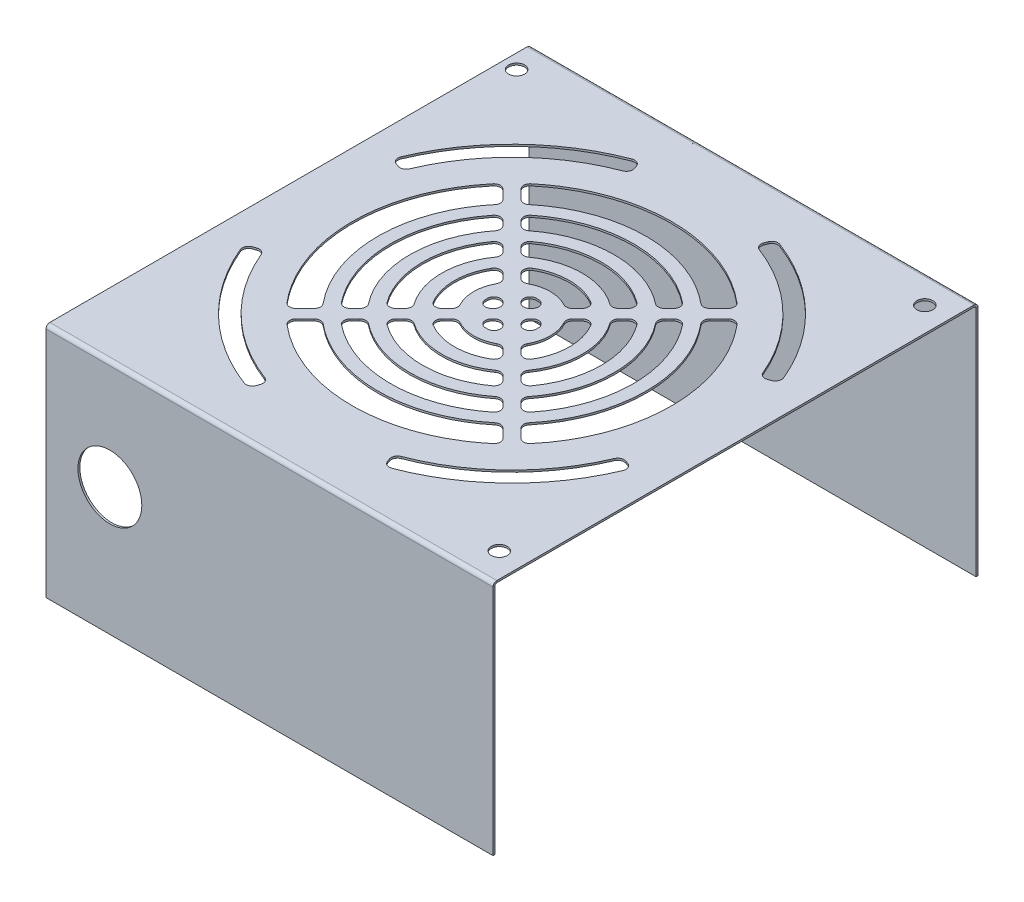
from build123d import *

# Parameters (mm, degrees)
BASE_FLANGE1_DEPTH = 70
VENT1_START        = 73.44
VENT1_DEPTH        = 0.6
CUT_EXTRUDE1_DEPTH = 10
SKETCH8_R          = 10
CUT_EXTRUDE2_DEPTH = 10
SKETCH9_R          = 2.5
CUT_EXTRUDE3_DEPTH = 10


# Read off the part's stored shape, not the designer's step: Vent1
# Sheet-metal steps are written as plain solids
with BuildPart() as part:
    # Sketch1 → Base-Flange1 (new, symmetric)
    with BuildSketch(Plane(origin=(0, 0, 0), x_dir=(0, 0, -1), z_dir=(1, 0, 0))):
        with BuildLine():
            Line((0, 0), (0, 72.84))
            ThreePointArc((0, 72.84), (0.175735931, 73.264264069), (0.6, 73.44))
            Line((0.6, 73.44), (150.07, 73.44))
            ThreePointArc((150.07, 73.44), (150.494264069, 73.264264069), (150.67, 72.84))
            Line((150.67, 72.84), (150.67, 0))
            Line((150.67, 0), (151.27, 0))
            Line((151.27, 0), (151.27, 72.84))
            ThreePointArc((151.27, 72.84), (150.918528137, 73.688528137), (150.07, 74.04))
            Line((150.07, 74.04), (0.6, 74.04))
            ThreePointArc((0.6, 74.04), (-0.248528137, 73.688528137), (-0.6, 72.84))
            Line((-0.6, 72.84), (-0.6, 0))
            Line((-0.6, 0), (0, 0))
        make_face()
    extrude(amount=BASE_FLANGE1_DEPTH, both=True)

    # Vent1 outline → Vent1 (cut)
    with BuildSketch(Plane(origin=(0, 0, 0), x_dir=(1, 0, 0), z_dir=(0, 1, 0)).offset(VENT1_START)):
        with BuildLine():
            ThreePointArc((-35.237668545, 107.74424142), (-36.735185194, 108.328292253), (-38.17889489, 107.621628399))
            add(Edge.make_bspline(
                [(-38.17889489, 107.621628399), (-38.337593554, 107.434004687), (-39.542377698, 105.988034091), (-41.639734537, 103.158002226), (-44.167935511, 98.943358751), (-46.267637176, 94.499881819), (-47.925023327, 89.872993996), (-49.117500466, 85.105265753), (-49.840379372, 80.243942285), (-50.079805759, 75.335183853), (-49.840397589, 70.426242674), (-49.117572202, 65.565094889), (-47.925077278, 60.797183854), (-46.267777889, 56.1704579), (-44.16802313, 51.726805148), (-41.639938796, 47.512303544), (-39.542488916, 44.682113272), (-38.33771236, 43.236135881), (-38.178894637, 43.048371463)],
                knots=[0.388277454, 0.388277454, 0.388277454, 0.388277454, 0.390624117, 0.406249996, 0.421874117, 0.437499996, 0.453124117, 0.468749996, 0.484374117, 0.499999996, 0.515624117, 0.531249996, 0.546874117, 0.562499996, 0.578124117, 0.593749996, 0.609374117, 0.61172254, 0.61172254, 0.61172254, 0.61172254], degree=3))
            ThreePointArc((-38.178894637, 43.048371463), (-36.735184981, 42.341707815), (-35.237668471, 42.925758654))
            Line((-35.237668471, 42.925758654), (-32.398421968, 45.765005157))
            ThreePointArc((-32.398421968, 45.765005157), (-31.814704678, 47.088266478), (-32.275778554, 48.459090054))
            add(Edge.make_bspline(
                [(-32.275778476, 102.210910081), (-32.339681127, 102.134176391), (-33.279116704, 100.997839753), (-34.977369953, 98.70633243), (-37.101062803, 95.166027013), (-38.864810367, 91.433512463), (-40.25701773, 87.546921101), (-41.258697914, 83.542035691), (-41.865918043, 79.458517909), (-42.067036838, 75.335167139), (-41.865934603, 71.211650236), (-41.258763128, 67.128292165), (-40.257066776, 63.123240582), (-38.86493829, 59.23679637), (-37.101142449, 55.504121994), (-34.977555668, 51.963945513), (-33.279217278, 49.67229472), (-32.339788351, 48.535952392), (-32.275778554, 48.459090054)],
                knots=[0.389488825, 0.389488825, 0.389488825, 0.389488825, 0.390624044, 0.406249995, 0.421874044, 0.437499995, 0.453124044, 0.468749995, 0.484374044, 0.499999995, 0.515624044, 0.531249995, 0.546874044, 0.562499995, 0.578124044, 0.593749995, 0.609374044, 0.610511167, 0.610511167, 0.610511167, 0.610511167], degree=3))
            ThreePointArc((-32.275778476, 102.210910081), (-31.8147047, 103.581733617), (-32.398421987, 104.904994862))
            Line((-32.398421987, 104.904994862), (-35.237668545, 107.74424142))
        make_face()
        with BuildLine():
            ThreePointArc((-32.409242255, 40.097330621), (-32.993293095, 38.599814132), (-32.286629479, 37.156104482))
            add(Edge.make_bspline(
                [(-32.286629479, 37.156104482), (-32.099002484, 36.99740299), (-30.653031738, 35.792618801), (-27.822991581, 33.695258793), (-23.608351397, 31.167060385), (-19.164866351, 29.067356461), (-14.537985919, 27.409974211), (-9.770249358, 26.217496276), (-4.908933878, 25.494619798), (-0.000167139, 25.255194241), (4.908765733, 25.494603238), (9.769921504, 26.217431059), (14.53782423, 27.409925174), (19.164557543, 29.067228506), (23.608202294, 31.166980859), (27.822710384, 33.695070464), (30.652893317, 35.792516171), (32.098870457, 36.99729296), (32.286628455, 37.156105228)],
                knots=[0.638277453, 0.638277453, 0.638277453, 0.638277453, 0.640624157, 0.656249996, 0.671874197, 0.687499996, 0.703124197, 0.718749996, 0.734374197, 0.749999996, 0.765624197, 0.781249996, 0.796874197, 0.812499996, 0.828124197, 0.843749996, 0.859374197, 0.861722539, 0.861722539, 0.861722539, 0.861722539], degree=3))
            ThreePointArc((32.286628455, 37.156105228), (32.993292217, 38.599814907), (32.409241381, 40.097331494))
            Line((32.409241381, 40.097331494), (29.569994843, 42.936578032))
            ThreePointArc((29.569994843, 42.936578032), (28.246733522, 43.520295322), (26.875909946, 43.059221446))
            add(Edge.make_bspline(
                [(-26.875910081, 43.059221524), (-26.799176391, 42.995318873), (-25.662839753, 42.055883296), (-23.37133243, 40.357630047), (-19.831027013, 38.233937197), (-16.098512463, 36.470189633), (-12.211921101, 35.07798227), (-8.207035691, 34.076302086), (-4.123517909, 33.469081957), (-0.000167139, 33.267963162), (4.123349764, 33.469065397), (8.206707835, 34.076236872), (12.211759418, 35.077933224), (16.09820363, 36.47006171), (19.830878006, 38.233857551), (23.371054487, 40.357444332), (25.66270528, 42.055782722), (26.799047608, 42.995211649), (26.875909946, 43.059221446)],
                knots=[0.639488825, 0.639488825, 0.639488825, 0.639488825, 0.640624044, 0.656249995, 0.671874044, 0.687499995, 0.703124044, 0.718749995, 0.734374044, 0.749999995, 0.765624044, 0.781249995, 0.796874044, 0.812499995, 0.828124044, 0.843749995, 0.859374044, 0.860511167, 0.860511167, 0.860511167, 0.860511167], degree=3))
            ThreePointArc((-26.875910081, 43.059221524), (-28.246733617, 43.5202953), (-29.569994862, 42.936578013))
            Line((-29.569994862, 42.936578013), (-32.409242255, 40.097330621))
        make_face()
        with BuildLine():
            ThreePointArc((32.409241439, 110.572668563), (32.993292271, 112.070185236), (32.286628381, 113.51389494))
            add(Edge.make_bspline(
                [(32.286628381, 113.51389494), (32.099004677, 113.67259359), (30.653034061, 114.877377664), (27.822998563, 116.974736542), (23.608356035, 119.502939391), (19.164870079, 121.602641643), (14.537985982, 123.260025916), (9.770249341, 124.45250369), (4.908933883, 125.17538021), (0.000167137, 125.414805759), (-4.908765728, 125.175396753), (-9.769921523, 124.452568978), (-14.53782416, 123.260074689), (-19.164553841, 121.602773423), (-23.60819756, 119.503019245), (-27.822700147, 116.974936816), (-30.652886651, 114.877488918), (-32.098864078, 113.672712403), (-32.28662848, 113.513894708)],
                knots=[0.138277454, 0.138277454, 0.138277454, 0.138277454, 0.140624117, 0.156249996, 0.171874157, 0.187499996, 0.203124197, 0.218749996, 0.234374197, 0.249999996, 0.265624197, 0.281249996, 0.296874197, 0.312499996, 0.328124157, 0.343749996, 0.359374117, 0.361722539, 0.361722539, 0.361722539, 0.361722539], degree=3))
            ThreePointArc((-32.28662848, 113.513894708), (-32.993292196, 112.070185039), (-32.409241358, 110.572668483))
            Line((-32.409241358, 110.572668483), (-29.569994843, 107.733421968))
            ThreePointArc((-29.569994843, 107.733421968), (-28.246733522, 107.149704678), (-26.875909946, 107.610778554))
            add(Edge.make_bspline(
                [(26.87591017, 107.610778424), (26.799182886, 107.674675735), (25.662846467, 108.614111594), (23.371342667, 110.312362674), (19.831031747, 112.436062699), (16.098516165, 114.199808438), (12.21192117, 115.592017867), (8.207035672, 116.593697877), (4.123517914, 117.200918052), (0.000167138, 117.402036836), (-4.123349764, 117.200934604), (-8.206707835, 116.593763128), (-12.211759418, 115.592066776), (-16.09820363, 114.19993829), (-19.830878006, 112.436142449), (-23.371054487, 110.312555668), (-25.66270528, 108.614217278), (-26.799047608, 107.674788351), (-26.875909946, 107.610778554)],
                knots=[0.139488824, 0.139488824, 0.139488824, 0.139488824, 0.140623949, 0.156249995, 0.171873996, 0.187499995, 0.203124044, 0.218749995, 0.234374044, 0.249999995, 0.265624044, 0.281249995, 0.296874044, 0.312499995, 0.328124044, 0.343749995, 0.359374044, 0.360511167, 0.360511167, 0.360511167, 0.360511167], degree=3))
            ThreePointArc((26.87591017, 107.610778424), (28.246733679, 107.149704715), (29.569994874, 107.733421999))
            Line((29.569994874, 107.733421999), (32.409241439, 110.572668563))
        make_face()
        with BuildLine():
            ThreePointArc((35.237668542, 42.925758583), (36.735185185, 42.341707749), (38.178894879, 43.048371594))
            add(Edge.make_bspline(
                [(38.178894879, 43.048371594), (38.337598954, 43.236001701), (39.542382752, 44.681972604), (41.639743794, 47.512011677), (44.167939595, 51.726648685), (46.267643196, 56.170133674), (47.925027181, 60.797013899), (49.117508708, 65.564792176), (49.840403961, 70.426105929), (50.000006913, 73.698674722), (50, 75.335), (49.999993088, 76.971236998), (49.840371138, 80.243801135), (49.117566807, 85.10495079), (47.925075713, 89.87281594), (46.26777831, 94.499542157), (44.168023011, 98.943194829), (41.639938851, 103.157696488), (39.542488886, 105.987886622), (38.337712436, 107.433864068), (38.178894755, 107.621628464)],
                knots=[0.888277454, 0.888277454, 0.888277454, 0.888277454, 0.890624197, 0.906249996, 0.921874197, 0.937499996, 0.953124197, 0.968749996, 0.984374599, 1, 1, 1, 1.015624558, 1.031249996, 1.046874117, 1.062499996, 1.078124117, 1.093749996, 1.109374117, 1.111722539, 1.111722539, 1.111722539, 1.111722539], degree=3))
            ThreePointArc((38.178894755, 107.621628464), (36.735185079, 108.328292213), (35.237668501, 107.744241376))
            Line((35.237668501, 107.744241376), (32.398421965, 104.904994841))
            ThreePointArc((32.398421965, 104.904994841), (31.814704675, 103.581733509), (32.275778565, 102.210909927))
            add(Edge.make_bspline(
                [(32.275778474, 48.459089915), (32.339681125, 48.535823606), (33.2791167, 49.672160246), (34.977369926, 51.963667574), (37.101062903, 55.503972973), (38.864809991, 59.236487587), (40.257019132, 63.123078711), (41.258702895, 67.128005846), (41.865941804, 71.211521899), (42.000006913, 73.960480045), (42, 75.335), (41.999993088, 76.709431675), (41.86590898, 79.458385165), (41.258760994, 83.54173712), (40.257067663, 87.546751128), (38.864945105, 91.433188243), (37.101146318, 95.165870541), (34.977564983, 98.706040592), (33.279222316, 100.997698558), (32.339793717, 102.13404116), (32.275778565, 102.210909927)],
                knots=[0.889488825, 0.889488825, 0.889488825, 0.889488825, 0.890624044, 0.906249995, 0.921874044, 0.937499995, 0.953124044, 0.968749995, 0.984374522, 1, 1, 1, 1.015624474, 1.031249995, 1.046873949, 1.062499995, 1.078123949, 1.093749995, 1.109373949, 1.110511166, 1.110511166, 1.110511166, 1.110511166], degree=3))
            ThreePointArc((32.275778474, 48.459089915), (31.814704701, 47.088266381), (32.398421987, 45.765005138))
            Line((32.398421987, 45.765005138), (35.237668542, 42.925758583))
        make_face()
        with BuildLine():
            ThreePointArc((1.748044523, 79.911471648), (2.202201241, 82.039262464), (0.445257533, 83.322578828))
            add(Edge.make_bspline(
                [(0.445257533, 83.322578828), (0.296991368, 83.330852074), (0, 83.339147926), (-0.296991368, 83.330852074), (-0.445257551, 83.322578827)],
                knots=[0.241137243, 0.241137243, 0.241137243, 0.241137243, 0.25, 0.258862757, 0.258862757, 0.258862757, 0.258862757], degree=3))
            ThreePointArc((-0.445257551, 83.322578827), (-2.202201241, 82.039262465), (-1.748044523, 79.911471648))
            Line((-1.748044523, 79.911471648), (-1.414213562, 79.577640687))
            ThreePointArc((-1.414213562, 79.577640687), (0, 78.991854249), (1.414213562, 79.577640687))
            Line((1.414213562, 79.577640687), (1.748044523, 79.911471648))
        make_face()
        with BuildLine():
            add(Edge.make_bspline(
                [(5.707183993, 85.89089554), (5.344945674, 86.086740839), (4.26255561, 86.601997096), (2.356174944, 87.180291349), (0, 87.412354326), (-2.356174944, 87.180291349), (-4.262555613, 86.601997095), (-5.344945679, 86.086740836), (-5.707184, 85.890895536)],
                knots=[0.171115403, 0.171115403, 0.171115403, 0.171115403, 0.1875, 0.21875, 0.25, 0.28125, 0.3125, 0.328884597, 0.328884597, 0.328884597, 0.328884597], degree=3))
            ThreePointArc((5.707183993, 85.89089554), (6.947118124, 85.671179092), (8.072584978, 86.236012103))
            Line((8.072584978, 86.236012103), (9.540203201, 87.703630326))
            ThreePointArc((9.540203201, 87.703630326), (10.110041057, 89.369915248), (9.141633618, 90.840767945))
            add(Edge.make_bspline(
                [(9.141633618, 90.840767945), (8.417949604, 91.267371377), (6.607666297, 92.170630149), (3.534262417, 93.102937023), (0, 93.451031488), (-3.534262417, 93.102937023), (-6.607666296, 92.170630149), (-8.417949603, 91.267371378), (-9.141633653, 90.840767925)],
                knots=[0.165216574, 0.165216574, 0.165216574, 0.165216574, 0.1875, 0.21875, 0.25, 0.28125, 0.3125, 0.334783426, 0.334783426, 0.334783426, 0.334783426], degree=3))
            ThreePointArc((-9.141633653, 90.840767925), (-10.110041057, 89.369915248), (-9.540203201, 87.703630326))
            Line((-9.540203201, 87.703630326), (-8.072584978, 86.236012103))
            ThreePointArc((-8.072584978, 86.236012103), (-6.947118124, 85.671179092), (-5.707184, 85.890895536))
        make_face()
        with BuildLine():
            ThreePointArc((-4.576471648, 77.083044523), (-6.704262464, 77.537201241), (-7.987578828, 75.780257533))
            add(Edge.make_bspline(
                [(-7.987578828, 75.780257533), (-7.995852074, 75.631991368), (-8.004147926, 75.335), (-7.995852074, 75.038008632), (-7.987578827, 74.889742449)],
                knots=[0.491137243, 0.491137243, 0.491137243, 0.491137243, 0.5, 0.508862757, 0.508862757, 0.508862757, 0.508862757], degree=3))
            ThreePointArc((-7.987578827, 74.889742449), (-6.704262465, 73.132798759), (-4.576471648, 73.586955477))
            Line((-4.576471648, 73.586955477), (-4.242640687, 73.920786438))
            ThreePointArc((-4.242640687, 73.920786438), (-3.656854249, 75.335), (-4.242640687, 76.749213562))
            Line((-4.242640687, 76.749213562), (-4.576471648, 77.083044523))
        make_face()
        with BuildLine():
            add(Edge.make_bspline(
                [(-10.55589554, 81.042183993), (-10.751740839, 80.679945674), (-11.266997096, 79.59755561), (-11.845291349, 77.691174944), (-12.077354326, 75.335), (-11.845291349, 72.978825056), (-11.266997095, 71.072444387), (-10.751740836, 69.990054321), (-10.555895536, 69.627816)],
                knots=[0.421115403, 0.421115403, 0.421115403, 0.421115403, 0.4375, 0.46875, 0.5, 0.53125, 0.5625, 0.578884597, 0.578884597, 0.578884597, 0.578884597], degree=3))
            ThreePointArc((-10.55589554, 81.042183993), (-10.336179092, 82.282118124), (-10.901012103, 83.407584978))
            Line((-10.901012103, 83.407584978), (-12.368630326, 84.875203201))
            ThreePointArc((-12.368630326, 84.875203201), (-14.034915248, 85.445041057), (-15.505767945, 84.476633618))
            add(Edge.make_bspline(
                [(-15.505767945, 84.476633618), (-15.932371377, 83.752949604), (-16.835630149, 81.942666297), (-17.767937023, 78.869262417), (-18.116031488, 75.335), (-17.767937023, 71.800737583), (-16.835630149, 68.727333704), (-15.932371378, 66.917050397), (-15.505767925, 66.193366347)],
                knots=[0.415216574, 0.415216574, 0.415216574, 0.415216574, 0.4375, 0.46875, 0.5, 0.53125, 0.5625, 0.584783426, 0.584783426, 0.584783426, 0.584783426], degree=3))
            ThreePointArc((-15.505767925, 66.193366347), (-14.034915248, 65.224958943), (-12.368630326, 65.794796799))
            Line((-12.368630326, 65.794796799), (-10.901012103, 67.262415022))
            ThreePointArc((-10.901012103, 67.262415022), (-10.336179092, 68.387881876), (-10.555895536, 69.627816))
        make_face()
        with BuildLine():
            ThreePointArc((-1.748044523, 70.758528352), (-2.202201241, 68.630737536), (-0.445257533, 67.347421172))
            add(Edge.make_bspline(
                [(-0.445257533, 67.347421172), (-0.296991368, 67.339147926), (0, 67.330852074), (0.296991368, 67.339147926), (0.445257551, 67.347421173)],
                knots=[0.741137243, 0.741137243, 0.741137243, 0.741137243, 0.75, 0.758862757, 0.758862757, 0.758862757, 0.758862757], degree=3))
            ThreePointArc((0.445257551, 67.347421173), (2.202201241, 68.630737535), (1.748044523, 70.758528352))
            Line((1.748044523, 70.758528352), (1.414213562, 71.092359313))
            ThreePointArc((1.414213562, 71.092359313), (0, 71.678145751), (-1.414213562, 71.092359313))
            Line((-1.414213562, 71.092359313), (-1.748044523, 70.758528352))
        make_face()
        with BuildLine():
            add(Edge.make_bspline(
                [(-5.707183993, 64.77910446), (-5.344945674, 64.583259161), (-4.26255561, 64.068002904), (-2.356174944, 63.489708651), (0, 63.257645674), (2.356174944, 63.489708651), (4.262555613, 64.068002905), (5.344945679, 64.583259164), (5.707184, 64.779104464)],
                knots=[0.671115403, 0.671115403, 0.671115403, 0.671115403, 0.6875, 0.71875, 0.75, 0.78125, 0.8125, 0.828884597, 0.828884597, 0.828884597, 0.828884597], degree=3))
            ThreePointArc((-5.707183993, 64.77910446), (-6.947118124, 64.998820908), (-8.072584978, 64.433987897))
            Line((-8.072584978, 64.433987897), (-9.540203201, 62.966369674))
            ThreePointArc((-9.540203201, 62.966369674), (-10.110041057, 61.300084752), (-9.141633618, 59.829232055))
            add(Edge.make_bspline(
                [(-9.141633618, 59.829232055), (-8.417949604, 59.402628623), (-6.607666297, 58.499369851), (-3.534262417, 57.567062977), (0, 57.218968512), (3.534262417, 57.567062977), (6.607666296, 58.499369851), (8.417949603, 59.402628622), (9.141633653, 59.829232075)],
                knots=[0.665216574, 0.665216574, 0.665216574, 0.665216574, 0.6875, 0.71875, 0.75, 0.78125, 0.8125, 0.834783426, 0.834783426, 0.834783426, 0.834783426], degree=3))
            ThreePointArc((9.141633653, 59.829232075), (10.110041057, 61.300084752), (9.540203201, 62.966369674))
            Line((9.540203201, 62.966369674), (8.072584978, 64.433987897))
            ThreePointArc((8.072584978, 64.433987897), (6.947118124, 64.998820908), (5.707184, 64.779104464))
        make_face()
        with BuildLine():
            add(Edge.make_bspline(
                [(10.55589554, 69.627816007), (10.751740839, 69.990054326), (11.266997096, 71.07244439), (11.845291349, 72.978825056), (12, 74.549608352), (12, 75.335), (12, 76.120391648), (11.845291349, 77.691174944), (11.266997095, 79.597555613), (10.751740836, 80.679945679), (10.555895536, 81.042184)],
                knots=[0.921115403, 0.921115403, 0.921115403, 0.921115403, 0.9375, 0.96875, 1, 1, 1, 1.03125, 1.0625, 1.078884597, 1.078884597, 1.078884597, 1.078884597], degree=3))
            ThreePointArc((10.55589554, 69.627816007), (10.336179092, 68.387881876), (10.901012103, 67.262415022))
            Line((10.901012103, 67.262415022), (12.368630326, 65.794796799))
            ThreePointArc((12.368630326, 65.794796799), (14.034915248, 65.224958943), (15.505767945, 66.193366382))
            add(Edge.make_bspline(
                [(15.505767945, 66.193366382), (15.932371377, 66.917050396), (16.835630149, 68.727333703), (17.767937023, 71.800737583), (18, 74.156912528), (18, 75.335), (18, 76.513087472), (17.767937023, 78.869262417), (16.835630149, 81.942666296), (15.932371378, 83.752949603), (15.505767925, 84.476633653)],
                knots=[0.915216574, 0.915216574, 0.915216574, 0.915216574, 0.9375, 0.96875, 1, 1, 1, 1.03125, 1.0625, 1.084783426, 1.084783426, 1.084783426, 1.084783426], degree=3))
            ThreePointArc((15.505767925, 84.476633653), (14.034915248, 85.445041057), (12.368630326, 84.875203201))
            Line((12.368630326, 84.875203201), (10.901012103, 83.407584978))
            ThreePointArc((10.901012103, 83.407584978), (10.336179092, 82.282118124), (10.555895536, 81.042184))
        make_face()
        with BuildLine():
            ThreePointArc((4.576471648, 73.586955477), (6.704262466, 73.13279876), (7.987578828, 74.889742471))
            add(Edge.make_bspline(
                [(7.987578828, 74.889742471), (7.995852074, 75.038008632), (8, 75.186504316), (8, 75.335), (8, 75.483495684), (7.995852074, 75.631991368), (7.987578827, 75.780257551)],
                knots=[0.991137243, 0.991137243, 0.991137243, 0.991137243, 1, 1, 1, 1.008862757, 1.008862757, 1.008862757, 1.008862757], degree=3))
            ThreePointArc((7.987578827, 75.780257551), (6.704262463, 77.537201241), (4.576471648, 77.083044523))
            Line((4.576471648, 77.083044523), (4.242640687, 76.749213562))
            ThreePointArc((4.242640687, 76.749213562), (3.656854249, 75.335), (4.242640687, 73.920786438))
            Line((4.242640687, 73.920786438), (4.576471648, 73.586955477))
        make_face()
        with BuildLine():
            add(Edge.make_bspline(
                [(12.745942792, 93.266536196), (12.573229067, 93.389317759), (11.213115362, 94.326912376), (8.473306247, 95.791370859), (4.319654065, 97.051367473), (0, 97.476816264), (-4.319654065, 97.051367473), (-8.473306247, 95.791370859), (-11.213115362, 94.326912376), (-12.573229067, 93.389317759), (-12.745942792, 93.266536196)],
                knots=[0.15165093, 0.15165093, 0.15165093, 0.15165093, 0.15625, 0.1875, 0.21875, 0.25, 0.28125, 0.3125, 0.34375, 0.34834907, 0.34834907, 0.34834907, 0.34834907], degree=3))
            ThreePointArc((12.745942792, 93.266536196), (14.071959063, 92.90361345), (15.31897145, 93.482398575))
            Line((15.31897145, 93.482398575), (16.751653306, 94.91508043))
            ThreePointArc((16.751653306, 94.91508043), (17.331483334, 96.483534585), (16.517351618, 97.944164875))
            add(Edge.make_bspline(
                [(16.517351618, 97.944164875), (16.201632209, 98.174846526), (14.37874274, 99.449062219), (10.78420795, 101.370381093), (5.497741537, 102.974013147), (0, 103.515493426), (-5.497741537, 102.974013147), (-10.78420795, 101.370381093), (-14.37874274, 99.449062219), (-16.201632209, 98.174846526), (-16.517351619, 97.944164875)],
                knots=[0.149582268, 0.149582268, 0.149582268, 0.149582268, 0.15625, 0.1875, 0.21875, 0.25, 0.28125, 0.3125, 0.34375, 0.350417732, 0.350417732, 0.350417732, 0.350417732], degree=3))
            ThreePointArc((-16.517351619, 97.944164875), (-17.331483334, 96.483534584), (-16.751653306, 94.91508043))
            Line((-16.751653306, 94.91508043), (-15.31897145, 93.482398575))
            ThreePointArc((-15.31897145, 93.482398575), (-14.07195906, 92.90361345), (-12.745942792, 93.266536196))
        make_face()
        with BuildLine():
            add(Edge.make_bspline(
                [(-17.931536196, 88.080942792), (-18.054317759, 87.908229067), (-18.991912376, 86.548115362), (-20.456370859, 83.808306247), (-21.716367473, 79.654654065), (-22.141816264, 75.335), (-21.716367473, 71.015345935), (-20.456370859, 66.861693753), (-18.991912376, 64.121884638), (-18.054317759, 62.761770933), (-17.931536196, 62.589057208)],
                knots=[0.40165093, 0.40165093, 0.40165093, 0.40165093, 0.40625, 0.4375, 0.46875, 0.5, 0.53125, 0.5625, 0.59375, 0.59834907, 0.59834907, 0.59834907, 0.59834907], degree=3))
            ThreePointArc((-17.931536196, 88.080942792), (-17.56861345, 89.406959063), (-18.147398575, 90.65397145))
            Line((-18.147398575, 90.65397145), (-19.58008043, 92.086653306))
            ThreePointArc((-19.58008043, 92.086653306), (-21.148534585, 92.666483334), (-22.609164875, 91.852351618))
            add(Edge.make_bspline(
                [(-22.609164875, 91.852351618), (-22.839846526, 91.536632209), (-24.114062219, 89.71374274), (-26.035381093, 86.11920795), (-27.639013147, 80.832741537), (-28.180493426, 75.335), (-27.639013147, 69.837258463), (-26.035381093, 64.55079205), (-24.114062219, 60.95625726), (-22.839846526, 59.133367791), (-22.609164875, 58.817648381)],
                knots=[0.399582268, 0.399582268, 0.399582268, 0.399582268, 0.40625, 0.4375, 0.46875, 0.5, 0.53125, 0.5625, 0.59375, 0.600417732, 0.600417732, 0.600417732, 0.600417732], degree=3))
            ThreePointArc((-22.609164875, 58.817648381), (-21.148534584, 58.003516666), (-19.58008043, 58.583346694))
            Line((-19.58008043, 58.583346694), (-18.147398575, 60.01602855))
            ThreePointArc((-18.147398575, 60.01602855), (-17.56861345, 61.26304094), (-17.931536196, 62.589057208))
        make_face()
        with BuildLine():
            add(Edge.make_bspline(
                [(-12.745942792, 57.403463804), (-12.573229067, 57.280682241), (-11.213115362, 56.343087624), (-8.473306247, 54.878629141), (-4.319654065, 53.618632527), (0, 53.193183736), (4.319654065, 53.618632527), (8.473306247, 54.878629141), (11.213115362, 56.343087624), (12.573229067, 57.280682241), (12.745942792, 57.403463804)],
                knots=[0.65165093, 0.65165093, 0.65165093, 0.65165093, 0.65625, 0.6875, 0.71875, 0.75, 0.78125, 0.8125, 0.84375, 0.84834907, 0.84834907, 0.84834907, 0.84834907], degree=3))
            ThreePointArc((-12.745942792, 57.403463804), (-14.071959063, 57.76638655), (-15.31897145, 57.187601425))
            Line((-15.31897145, 57.187601425), (-16.751653306, 55.75491957))
            ThreePointArc((-16.751653306, 55.75491957), (-17.331483334, 54.186465415), (-16.517351618, 52.725835125))
            add(Edge.make_bspline(
                [(-16.517351618, 52.725835125), (-16.201632209, 52.495153474), (-14.37874274, 51.220937781), (-10.78420795, 49.299618907), (-5.497741537, 47.695986853), (0, 47.154506574), (5.497741537, 47.695986853), (10.78420795, 49.299618907), (14.37874274, 51.220937781), (16.201632209, 52.495153474), (16.517351619, 52.725835125)],
                knots=[0.649582268, 0.649582268, 0.649582268, 0.649582268, 0.65625, 0.6875, 0.71875, 0.75, 0.78125, 0.8125, 0.84375, 0.850417732, 0.850417732, 0.850417732, 0.850417732], degree=3))
            ThreePointArc((16.517351619, 52.725835125), (17.331483334, 54.186465416), (16.751653306, 55.75491957))
            Line((16.751653306, 55.75491957), (15.31897145, 57.187601425))
            ThreePointArc((15.31897145, 57.187601425), (14.07195906, 57.76638655), (12.745942792, 57.403463804))
        make_face()
        with BuildLine():
            add(Edge.make_bspline(
                [(17.931536196, 62.589057208), (18.054317759, 62.761770933), (18.991912376, 64.121884638), (20.456370859, 66.861693753), (21.716367473, 71.015345935), (22, 73.895115312), (22, 75.335), (22, 76.774884688), (21.716367473, 79.654654065), (20.456370859, 83.808306247), (18.991912376, 86.548115362), (18.054317759, 87.908229067), (17.931536196, 88.080942792)],
                knots=[0.90165093, 0.90165093, 0.90165093, 0.90165093, 0.90625, 0.9375, 0.96875, 1, 1, 1, 1.03125, 1.0625, 1.09375, 1.09834907, 1.09834907, 1.09834907, 1.09834907], degree=3))
            ThreePointArc((17.931536196, 62.589057208), (17.56861345, 61.263040937), (18.147398575, 60.01602855))
            Line((18.147398575, 60.01602855), (19.58008043, 58.583346694))
            ThreePointArc((19.58008043, 58.583346694), (21.148534585, 58.003516666), (22.609164875, 58.817648382))
            add(Edge.make_bspline(
                [(22.609164875, 58.817648382), (22.839846526, 59.133367791), (24.114062219, 60.95625726), (26.035381093, 64.55079205), (27.639013147, 69.837258463), (28, 73.502419488), (28, 75.335), (28, 77.167580512), (27.639013147, 80.832741537), (26.035381093, 86.11920795), (24.114062219, 89.71374274), (22.839846526, 91.536632209), (22.609164875, 91.852351619)],
                knots=[0.899582268, 0.899582268, 0.899582268, 0.899582268, 0.90625, 0.9375, 0.96875, 1, 1, 1, 1.03125, 1.0625, 1.09375, 1.100417732, 1.100417732, 1.100417732, 1.100417732], degree=3))
            ThreePointArc((22.609164875, 91.852351619), (21.148534584, 92.666483334), (19.58008043, 92.086653306))
            Line((19.58008043, 92.086653306), (18.147398575, 90.65397145))
            ThreePointArc((18.147398575, 90.65397145), (17.56861345, 89.40695906), (17.931536196, 88.080942792))
        make_face()
        with BuildLine():
            add(Edge.make_bspline(
                [(19.808104351, 100.4672827), (19.151097198, 100.985138172), (16.778177952, 102.709345997), (12.324809086, 105.089721249), (6.283133185, 106.922443597), (0, 107.541278202), (-6.283133185, 106.922443597), (-12.324809086, 105.089721249), (-16.778177952, 102.709345997), (-19.151097198, 100.985138172), (-19.808104351, 100.4672827)],
                knots=[0.143767906, 0.143767906, 0.143767906, 0.143767906, 0.15625, 0.1875, 0.21875, 0.25, 0.28125, 0.3125, 0.34375, 0.356232094, 0.356232094, 0.356232094, 0.356232094], degree=3))
            ThreePointArc((19.808104351, 100.4672827), (21.163986968, 100.041491517), (22.460377231, 100.623804356))
            Line((22.460377231, 100.623804356), (23.884305795, 102.04773292))
            ThreePointArc((23.884305795, 102.04773292), (24.466988647, 103.573322914), (23.718268703, 105.024654228))
            add(Edge.make_bspline(
                [(23.718268703, 105.024654228), (22.876974493, 105.696618413), (21.00220811, 107.067140169), (17.942372319, 108.902620473), (14.565350949, 110.498387369), (11.048896779, 111.758011252), (7.425445249, 112.664291747), (3.730818331, 113.213686134), (0.000183853, 113.395652378), (-3.730633372, 113.213704351), (-7.425084608, 112.664363483), (-11.048718928, 111.758065202), (-14.565011232, 110.498528084), (-17.942208411, 108.902708084), (-21.002059862, 107.067248572), (-22.876974629, 105.696618483), (-23.71826887, 105.024654158)],
                knots=[0.142721099, 0.142721099, 0.142721099, 0.142721099, 0.156249994, 0.171873838, 0.187499994, 0.203123838, 0.218749994, 0.234373838, 0.249999994, 0.265623838, 0.281249994, 0.296873838, 0.312499994, 0.328123838, 0.343749994, 0.357278892, 0.357278892, 0.357278892, 0.357278892], degree=3))
            ThreePointArc((-23.71826887, 105.024654158), (-24.466988687, 103.573322865), (-23.88430583, 102.047732955))
            Line((-23.88430583, 102.047732955), (-22.460377231, 100.623804356))
            ThreePointArc((-22.460377231, 100.623804356), (-21.163986971, 100.041491517), (-19.808104351, 100.4672827))
        make_face()
        with BuildLine():
            add(Edge.make_bspline(
                [(-25.1322827, 95.143104351), (-25.650138172, 94.486097198), (-27.374345997, 92.113177952), (-29.754721249, 87.659809086), (-31.587443597, 81.618133185), (-32.206278202, 75.335), (-31.587443597, 69.051866815), (-29.754721249, 63.010190914), (-27.374345997, 58.556822048), (-25.650138172, 56.183902802), (-25.1322827, 55.526895649)],
                knots=[0.393767906, 0.393767906, 0.393767906, 0.393767906, 0.40625, 0.4375, 0.46875, 0.5, 0.53125, 0.5625, 0.59375, 0.606232094, 0.606232094, 0.606232094, 0.606232094], degree=3))
            ThreePointArc((-25.1322827, 95.143104351), (-24.706491517, 96.498986968), (-25.288804356, 97.795377231))
            Line((-25.288804356, 97.795377231), (-26.71273292, 99.219305795))
            ThreePointArc((-26.71273292, 99.219305795), (-28.238322914, 99.801988647), (-29.689654228, 99.053268703))
            add(Edge.make_bspline(
                [(-29.689654228, 99.053268703), (-30.361618413, 98.211974493), (-31.732140169, 96.33720811), (-33.567620473, 93.277372319), (-35.163387369, 89.900350949), (-36.423011252, 86.383896779), (-37.329291747, 82.760445249), (-37.878686134, 79.065818331), (-38.060652378, 75.335183853), (-37.878704351, 71.604366628), (-37.329363483, 67.909915392), (-36.423065203, 64.286281072), (-35.163528082, 60.76998877), (-33.567708091, 57.392791581), (-31.732248533, 54.332940144), (-30.361618498, 52.458025272), (-29.689654124, 51.616731045)],
                knots=[0.392721099, 0.392721099, 0.392721099, 0.392721099, 0.406249994, 0.421873838, 0.437499994, 0.453123838, 0.468749994, 0.484373838, 0.499999994, 0.515623838, 0.531249994, 0.546873838, 0.562499994, 0.578123838, 0.593749994, 0.607278892, 0.607278892, 0.607278892, 0.607278892], degree=3))
            ThreePointArc((-29.689654124, 51.616731045), (-28.238322842, 50.868011292), (-26.712732974, 51.450694151))
            Line((-26.712732974, 51.450694151), (-25.288804356, 52.874622769))
            ThreePointArc((-25.288804356, 52.874622769), (-24.706491517, 54.171013029), (-25.1322827, 55.526895649))
        make_face()
        with BuildLine():
            add(Edge.make_bspline(
                [(-19.808104351, 50.2027173), (-19.151097198, 49.684861828), (-16.778177952, 47.960654003), (-12.324809086, 45.580278751), (-6.283133185, 43.747556403), (0, 43.128721798), (6.283133185, 43.747556403), (12.324809086, 45.580278751), (16.778177952, 47.960654003), (19.151097198, 49.684861828), (19.808104351, 50.2027173)],
                knots=[0.643767906, 0.643767906, 0.643767906, 0.643767906, 0.65625, 0.6875, 0.71875, 0.75, 0.78125, 0.8125, 0.84375, 0.856232094, 0.856232094, 0.856232094, 0.856232094], degree=3))
            ThreePointArc((-19.808104351, 50.2027173), (-21.163986968, 50.628508483), (-22.460377231, 50.046195644))
            Line((-22.460377231, 50.046195644), (-23.884306644, 48.622266231))
            ThreePointArc((-23.884306644, 48.622266231), (-24.466989486, 47.096676059), (-23.718269273, 45.645344701))
            add(Edge.make_bspline(
                [(-23.718269273, 45.645344701), (-22.876975008, 44.973380717), (-21.002200978, 43.602855292), (-17.942364964, 41.767375423), (-14.565335481, 40.171606268), (-11.048888702, 38.911986286), (-7.425428855, 38.005704995), (-3.730809924, 37.456313036), (-0.000167139, 37.274347622), (3.73064178, 37.456296476), (7.425101001, 38.005639778), (11.048727012, 38.911937249), (14.565026673, 40.171478313), (17.942215862, 41.767295897), (21.002066601, 43.602756356), (22.876974623, 44.973381519), (23.718268862, 45.645345839)],
                knots=[0.642721101, 0.642721101, 0.642721101, 0.642721101, 0.656249995, 0.671873944, 0.687499995, 0.703123944, 0.718749995, 0.734373944, 0.749999995, 0.765623944, 0.781249995, 0.796873944, 0.812499995, 0.828123944, 0.843749995, 0.857278892, 0.857278892, 0.857278892, 0.857278892], degree=3))
            ThreePointArc((23.718268862, 45.645345839), (24.466988685, 47.096677133), (23.884305829, 48.622267047))
            Line((23.884305829, 48.622267047), (22.460377231, 50.046195644))
            ThreePointArc((22.460377231, 50.046195644), (21.163986971, 50.628508483), (19.808104351, 50.2027173))
        make_face()
        with BuildLine():
            add(Edge.make_bspline(
                [(25.1322827, 55.526895649), (25.650138172, 56.183902802), (27.374345997, 58.556822048), (29.754721249, 63.010190914), (31.587443597, 69.051866815), (32, 73.240622272), (32, 75.335), (32, 77.429377728), (31.587443597, 81.618133185), (29.754721249, 87.659809086), (27.374345997, 92.113177952), (25.650138172, 94.486097198), (25.1322827, 95.143104351)],
                knots=[0.893767906, 0.893767906, 0.893767906, 0.893767906, 0.90625, 0.9375, 0.96875, 1, 1, 1, 1.03125, 1.0625, 1.09375, 1.106232094, 1.106232094, 1.106232094, 1.106232094], degree=3))
            ThreePointArc((25.1322827, 55.526895649), (24.706491517, 54.171013032), (25.288804356, 52.874622769))
            Line((25.288804356, 52.874622769), (26.71273292, 51.450694204))
            ThreePointArc((26.71273292, 51.450694204), (28.238322915, 50.868011352), (29.689654229, 51.616731297))
            add(Edge.make_bspline(
                [(29.689654229, 51.616731297), (30.361618414, 52.458025506), (31.732145076, 54.332798634), (33.567624557, 57.392635117), (35.163393389, 60.769664544), (36.423015107, 64.286111117), (37.329299989, 67.909612681), (37.878710725, 71.604229883), (38.000006913, 74.091382707), (38, 75.335), (37.999993088, 76.578529013), (37.878677901, 79.06567718), (37.329358088, 82.760130285), (36.423063638, 86.383718722), (35.163528503, 89.900011287), (33.567707972, 93.277208396), (31.732248594, 96.337059868), (30.361618487, 98.211974636), (29.689654153, 99.053268878)],
                knots=[0.8927211, 0.8927211, 0.8927211, 0.8927211, 0.906249995, 0.921873944, 0.937499995, 0.953123944, 0.968749995, 0.984374472, 1, 1, 1, 1.015624419, 1.031249994, 1.046873838, 1.062499994, 1.078123838, 1.093749994, 1.107278892, 1.107278892, 1.107278892, 1.107278892], degree=3))
            ThreePointArc((29.689654153, 99.053268878), (28.238322862, 99.801988688), (26.712732956, 99.219305831))
            Line((26.712732956, 99.219305831), (25.288804356, 97.795377231))
            ThreePointArc((25.288804356, 97.795377231), (24.706491517, 96.498986971), (25.1322827, 95.143104351))
        make_face()
    extrude(amount=VENT1_DEPTH, mode=Mode.SUBTRACT)

    # Sketch7 → Cut-Extrude1 (cut)
    with BuildSketch(Plane(origin=(0, 74.04, 0), x_dir=(1, 0, 0), z_dir=(0, 1, 0))):
        with BuildLine():
            Line((-58.772721438, 97.842191436), (-57.83190902, 97.499763719))
            ThreePointArc((-57.83190902, 97.499763719), (-56.347462216, 97.546296155), (-55.304389097, 98.603531253))
            ThreePointArc((-55.304389097, 98.603531253), (-41.702552938, 118.473116307), (-21.38416897, 131.394943966))
            ThreePointArc((-21.38416897, 131.394943966), (-20.277925621, 132.432308094), (-20.217589361, 133.947649051))
            Line((-20.217589361, 133.947649051), (-20.559649158, 134.88745062))
            ThreePointArc((-20.559649158, 134.88745062), (-21.607512123, 136.022358025), (-23.151384698, 136.072248757))
            ThreePointArc((-23.151384698, 136.072248757), (-45.190328449, 122.055811366), (-59.932766268, 100.495753715))
            ThreePointArc((-59.932766268, 100.495753715), (-59.921221112, 98.920454155), (-58.772721438, 97.842191436))
        make_face()
        with BuildLine():
            Line((20.559649158, 134.88745062), (20.217589361, 133.947649051))
            ThreePointArc((20.217589361, 133.947649051), (20.277925621, 132.432308094), (21.38416897, 131.394943966))
            ThreePointArc((21.38416897, 131.394943966), (41.702552938, 118.473116307), (55.304389097, 98.603531253))
            ThreePointArc((55.304389097, 98.603531253), (56.347462216, 97.546296155), (57.83190902, 97.499763719))
            Line((57.83190902, 97.499763719), (58.772721438, 97.842191436))
            ThreePointArc((58.772721438, 97.842191436), (59.921221112, 98.920454155), (59.932766268, 100.495753715))
            ThreePointArc((59.932766268, 100.495753715), (45.190328449, 122.055811366), (23.151384698, 136.072248757))
            ThreePointArc((23.151384698, 136.072248757), (21.607512123, 136.022358025), (20.559649158, 134.88745062))
        make_face()
        with BuildLine():
            Line((58.772721438, 52.827808564), (57.83190902, 53.170236281))
            ThreePointArc((57.83190902, 53.170236281), (56.347462216, 53.123703845), (55.304389097, 52.066468747))
            ThreePointArc((55.304389097, 52.066468747), (41.702552938, 32.196883693), (21.38416897, 19.275056034))
            ThreePointArc((21.38416897, 19.275056034), (20.277925621, 18.237691906), (20.217589361, 16.722350949))
            Line((20.217589361, 16.722350949), (20.559649158, 15.78254938))
            ThreePointArc((20.559649158, 15.78254938), (21.607512123, 14.647641975), (23.151384698, 14.597751243))
            ThreePointArc((23.151384698, 14.597751243), (45.190328449, 28.614188634), (59.932766268, 50.174246285))
            ThreePointArc((59.932766268, 50.174246285), (59.921221112, 51.749545845), (58.772721438, 52.827808564))
        make_face()
        with BuildLine():
            Line((-20.559649158, 15.78254938), (-20.217589361, 16.722350949))
            ThreePointArc((-20.217589361, 16.722350949), (-20.277925621, 18.237691906), (-21.38416897, 19.275056034))
            ThreePointArc((-21.38416897, 19.275056034), (-41.702552938, 32.196883693), (-55.304389097, 52.066468747))
            ThreePointArc((-55.304389097, 52.066468747), (-56.347462216, 53.123703845), (-57.83190902, 53.170236281))
            Line((-57.83190902, 53.170236281), (-58.772721438, 52.827808564))
            ThreePointArc((-58.772721438, 52.827808564), (-59.921221112, 51.749545845), (-59.932766268, 50.174246285))
            ThreePointArc((-59.932766268, 50.174246285), (-45.190328449, 28.614188634), (-23.151384698, 14.597751243))
            ThreePointArc((-23.151384698, 14.597751243), (-21.607512123, 14.647641975), (-20.559649158, 15.78254938))
        make_face()
    extrude(amount=-CUT_EXTRUDE1_DEPTH, mode=Mode.SUBTRACT)

    # Sketch8 → Cut-Extrude2 (cut)
    with BuildSketch(Plane.XY.offset(0.6)):
        with Locations((-50, 40)):
            Circle(SKETCH8_R)
    extrude(amount=-CUT_EXTRUDE2_DEPTH, mode=Mode.SUBTRACT)

    # Sketch9 → Cut-Extrude3 (cut)
    with BuildSketch(Plane(origin=(0, 74.04, 0), x_dir=(1, 0, 0), z_dir=(0, 1, 0))):
        with Locations(Location((-65.5, 142.27, 0), (0, 0, 270))):
            Circle(SKETCH9_R)
        with Locations(Location((62.35, 142.27, 0), (0, 0, 270))):
            Circle(SKETCH9_R)
        with Locations(Location((62.35, 9, 0), (0, 0, 270))):
            Circle(SKETCH9_R)
    extrude(amount=-CUT_EXTRUDE3_DEPTH, mode=Mode.SUBTRACT)


solid = part.part
